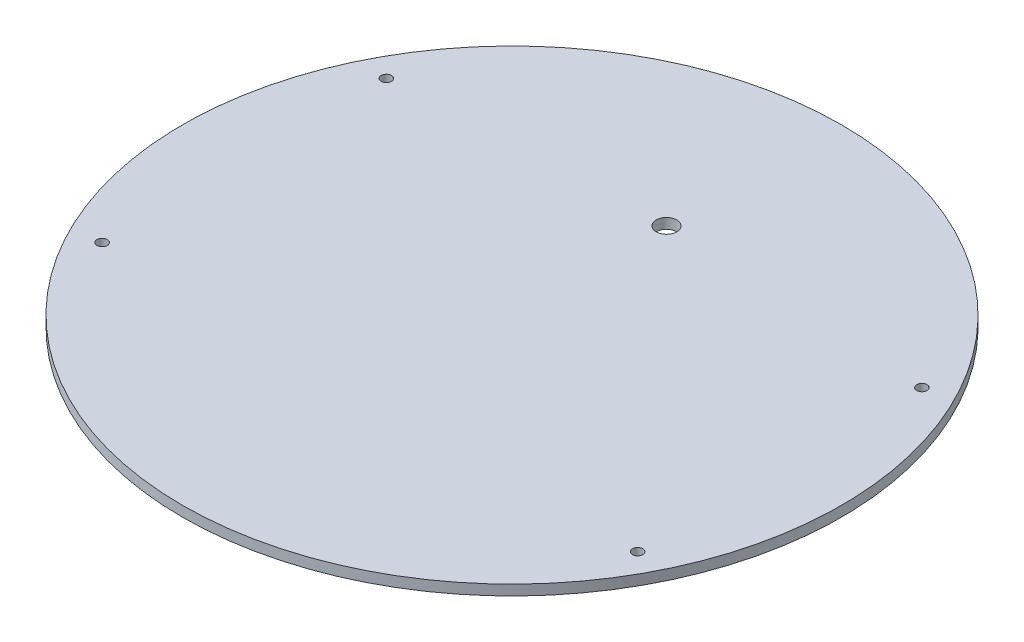
from build123d import *

# Parameters (mm, degrees)
SKETCH1_R           = 101.6
BOSS_EXTRUDE1_DEPTH = 3.175
CUT_EXTRUDE1_REACH  = 145.719
SKETCH2_R           = 1.5875
CUT_EXTRUDE2_REACH  = 145.719
SKETCH3_R           = 3.175


with BuildPart() as part:
    # Sketch1 → Boss-Extrude1 (new body)
    with BuildSketch(Plane(origin=(0, 0, 0), x_dir=(1, 0, 0), z_dir=(0, 1, 0))):
        Circle(SKETCH1_R)
    extrude(amount=BOSS_EXTRUDE1_DEPTH)

    # Sketch2 → Cut-Extrude1 (cut, up to next)
    with BuildSketch(Plane(origin=(0, 3.175, 0), x_dir=(1, 0, 0), z_dir=(0, 1, 0)), mode=Mode.PRIVATE) as cut_extrude1_sk1:
        with Locations((-82.55, 43.815)):
            Circle(SKETCH2_R)
    cut_extrude1_tool1 = extrude(cut_extrude1_sk1.sketch, amount=-CUT_EXTRUDE1_REACH, mode=Mode.PRIVATE) & part.part
    # Sketch2 → Cut-Extrude1 (cut, up to next)
    with BuildSketch(Plane(origin=(0, 3.175, 0), x_dir=(1, 0, 0), z_dir=(0, 1, 0)), mode=Mode.PRIVATE) as cut_extrude1_sk2:
        with Locations((82.55, 43.815)):
            Circle(SKETCH2_R)
    cut_extrude1_tool2 = extrude(cut_extrude1_sk2.sketch, amount=-CUT_EXTRUDE1_REACH, mode=Mode.PRIVATE) & part.part
    # Sketch2 → Cut-Extrude1 (cut, up to next)
    with BuildSketch(Plane(origin=(0, 3.175, 0), x_dir=(1, 0, 0), z_dir=(0, 1, 0)), mode=Mode.PRIVATE) as cut_extrude1_sk3:
        with Locations((-82.55, -43.815)):
            Circle(SKETCH2_R)
    cut_extrude1_tool3 = extrude(cut_extrude1_sk3.sketch, amount=-CUT_EXTRUDE1_REACH, mode=Mode.PRIVATE) & part.part
    # Sketch2 → Cut-Extrude1 (cut, up to next)
    with BuildSketch(Plane(origin=(0, 3.175, 0), x_dir=(1, 0, 0), z_dir=(0, 1, 0)), mode=Mode.PRIVATE) as cut_extrude1_sk4:
        with Locations((82.55, -43.815)):
            Circle(SKETCH2_R)
    cut_extrude1_tool4 = extrude(cut_extrude1_sk4.sketch, amount=-CUT_EXTRUDE1_REACH, mode=Mode.PRIVATE) & part.part
    add(cut_extrude1_tool1.solids().sort_by_distance((-82.55, 3.175, -43.815))[0], mode=Mode.SUBTRACT)
    add(cut_extrude1_tool2.solids().sort_by_distance((82.55, 3.175, -43.815))[0], mode=Mode.SUBTRACT)
    add(cut_extrude1_tool3.solids().sort_by_distance((-82.55, 3.175, 43.815))[0], mode=Mode.SUBTRACT)
    add(cut_extrude1_tool4.solids().sort_by_distance((82.55, 3.175, 43.815))[0], mode=Mode.SUBTRACT)

    # Sketch3 → Cut-Extrude2 (cut, up to next)
    with BuildSketch(Plane(origin=(0, 3.175, 0), x_dir=(1, 0, 0), z_dir=(0, 1, 0)), mode=Mode.PRIVATE) as cut_extrude2_sk1:
        with Locations((0, 47.625)):
            Circle(SKETCH3_R)
    cut_extrude2_tool1 = extrude(cut_extrude2_sk1.sketch, amount=-CUT_EXTRUDE2_REACH, mode=Mode.PRIVATE) & part.part
    add(cut_extrude2_tool1.solids().sort_by_distance((0, 3.175, -47.625))[0], mode=Mode.SUBTRACT)


solid = part.part
